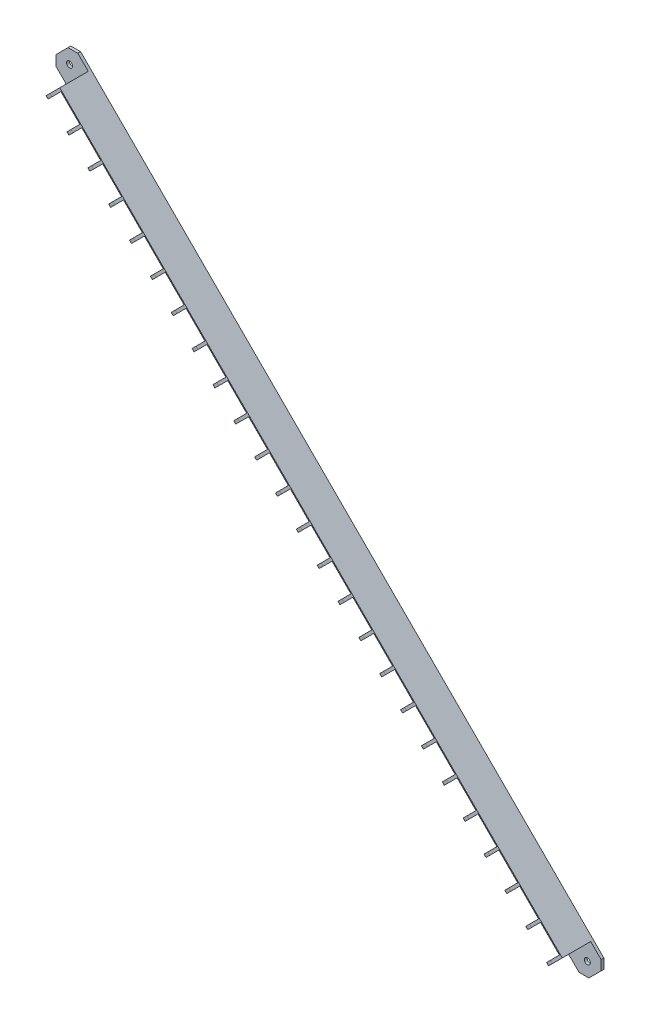
from build123d import *

# Parameters (mm, degrees)
BOSS_EXTRUDE2_DEPTH = 15.4
BOSS_EXTRUDE4_DEPTH = 1.6
LPATTERN1_COUNT     = 24
LPATTERN1_PITCH     = 17
BOSS_EXTRUDE5_START = 1.6
BOSS_EXTRUDE5_DEPTH = 1.6
SKETCH5_R           = 1.75
BOSS_EXTRUDE6_DEPTH = 1.6
CHAMFER1_SIZE       = 4


# Read off the part's stored shape, not the designer's step: Imported1
with BuildPart() as part:
    # Sketch2 → Boss-Extrude2 (new body)
    with BuildSketch(Plane(origin=(-84.711375962, 84.711326374, 0), x_dir=(0, 0, 1), z_dir=(-0.7071069881470023, 0.7071065742260323, 0))):
        with BuildLine():
            Line((17.999999225, 185.776650849), (17.999999225, 185.215701934))
            ThreePointArc((17.999999225, 185.215701934), (17.943392582, 185.010537776), (17.789566889, 184.863451745))
            Line((17.789566889, 184.863451745), (11.840286665, 181.661737422))
            ThreePointArc((11.840286665, 181.661737422), (10.948821205, 181.606515994), (10.368812829, 182.285743759))
            Line((10.368812829, 182.285743759), (9.722721647, 183.478557215))
            Line((9.722721647, 183.478557215), (9.01561146, 184.185660591))
            Line((9.01561146, 184.185660591), (1.590990258, 176.761039388))
            Line((1.590990258, 176.761039388), (2.298093634, 176.053929202))
            Line((2.298093634, 176.053929202), (3.49090709, 175.407838019))
            ThreePointArc((3.49090709, 175.407838019), (4.170134855, 174.827829644), (4.114913426, 173.936364184))
            Line((4.114913426, 173.936364184), (0.913199103, 167.987083959))
            ThreePointArc((0.913199103, 167.987083959), (0.766113073, 167.833258267), (0.560948914, 167.776651623))
            Line((0.560948914, 167.776651623), (0, 167.776651623))
            Line((0, 167.776651623), (0, 185.776650849))
            Line((0, 185.776650849), (17.999999225, 185.776650849))
        make_face()
    extrude(amount=BOSS_EXTRUDE2_DEPTH)

    # Sketch3 → Boss-Extrude4 (add)
    with BuildSketch(Plane(origin=(-84.711375962, 84.711326374, 0), x_dir=(0, 0, 1), z_dir=(-0.7071069881470023, 0.7071065742260323, 0))):
        with BuildLine():
            Line((17.999999225, 185.776650849), (17.999999225, 177.776650849))
            ThreePointArc((17.999999225, 177.776650849), (15.071067538, 170.705583859), (8.000000775, 167.776651623))
            Line((8.000000775, 167.776651623), (0, 167.776651623))
            Line((0, 167.776651623), (0, 185.776650849))
            Line((0, 185.776650849), (17.999999225, 185.776650849))
        make_face()
        with BuildLine():
            Line((7.424621202, 178.352029646), (10.253048327, 181.180456771))
            ThreePointArc((10.253048327, 181.180456771), (10.478608064, 181.715538219), (10.368812829, 182.285743759))
            Line((10.368812829, 182.285743759), (9.722721647, 183.478557215))
            Line((9.722721647, 183.478557215), (9.01561146, 184.185660591))
            Line((9.01561146, 184.185660591), (1.590990258, 176.761039388))
            Line((1.590990258, 176.761039388), (2.298093634, 176.053929202))
            Line((2.298093634, 176.053929202), (3.49090709, 175.407838019))
            ThreePointArc((3.49090709, 175.407838019), (4.06111263, 175.298042785), (4.596194078, 175.523602521))
            Line((4.596194078, 175.523602521), (7.424621202, 178.352029646))
        make_face(mode=Mode.SUBTRACT)
    extrude(amount=-BOSS_EXTRUDE4_DEPTH)


with BuildPart() as lpattern1_1:
    # LPattern1: pattern copy
    add(part.part.moved(Location(Vector(-0.7071069881470021, 0.7071065742260323, 0) * (1 * LPATTERN1_PITCH))))


with BuildPart() as lpattern1_2:
    # LPattern1: pattern copy
    add(part.part.moved(Location(Vector(-0.7071069881470021, 0.7071065742260323, 0) * (2 * LPATTERN1_PITCH))))


with BuildPart() as lpattern1_3:
    # LPattern1: pattern copy
    add(part.part.moved(Location(Vector(-0.7071069881470021, 0.7071065742260323, 0) * (3 * LPATTERN1_PITCH))))


with BuildPart() as lpattern1_4:
    # LPattern1: pattern copy
    add(part.part.moved(Location(Vector(-0.7071069881470021, 0.7071065742260323, 0) * (4 * LPATTERN1_PITCH))))


with BuildPart() as lpattern1_5:
    # LPattern1: pattern copy
    add(part.part.moved(Location(Vector(-0.7071069881470021, 0.7071065742260323, 0) * (5 * LPATTERN1_PITCH))))


with BuildPart() as lpattern1_6:
    # LPattern1: pattern copy
    add(part.part.moved(Location(Vector(-0.7071069881470021, 0.7071065742260323, 0) * (6 * LPATTERN1_PITCH))))


with BuildPart() as lpattern1_7:
    # LPattern1: pattern copy
    add(part.part.moved(Location(Vector(-0.7071069881470021, 0.7071065742260323, 0) * (7 * LPATTERN1_PITCH))))


with BuildPart() as lpattern1_8:
    # LPattern1: pattern copy
    add(part.part.moved(Location(Vector(-0.7071069881470021, 0.7071065742260323, 0) * (8 * LPATTERN1_PITCH))))


with BuildPart() as lpattern1_9:
    # LPattern1: pattern copy
    add(part.part.moved(Location(Vector(-0.7071069881470021, 0.7071065742260323, 0) * (9 * LPATTERN1_PITCH))))


with BuildPart() as lpattern1_10:
    # LPattern1: pattern copy
    add(part.part.moved(Location(Vector(-0.7071069881470021, 0.7071065742260323, 0) * (10 * LPATTERN1_PITCH))))


with BuildPart() as lpattern1_11:
    # LPattern1: pattern copy
    add(part.part.moved(Location(Vector(-0.7071069881470021, 0.7071065742260323, 0) * (11 * LPATTERN1_PITCH))))


with BuildPart() as lpattern1_12:
    # LPattern1: pattern copy
    add(part.part.moved(Location(Vector(-0.7071069881470021, 0.7071065742260323, 0) * (12 * LPATTERN1_PITCH))))


with BuildPart() as lpattern1_13:
    # LPattern1: pattern copy
    add(part.part.moved(Location(Vector(-0.7071069881470021, 0.7071065742260323, 0) * (13 * LPATTERN1_PITCH))))


with BuildPart() as lpattern1_14:
    # LPattern1: pattern copy
    add(part.part.moved(Location(Vector(-0.7071069881470021, 0.7071065742260323, 0) * (14 * LPATTERN1_PITCH))))


with BuildPart() as lpattern1_15:
    # LPattern1: pattern copy
    add(part.part.moved(Location(Vector(-0.7071069881470021, 0.7071065742260323, 0) * (15 * LPATTERN1_PITCH))))


with BuildPart() as lpattern1_16:
    # LPattern1: pattern copy
    add(part.part.moved(Location(Vector(-0.7071069881470021, 0.7071065742260323, 0) * (16 * LPATTERN1_PITCH))))


with BuildPart() as lpattern1_17:
    # LPattern1: pattern copy
    add(part.part.moved(Location(Vector(-0.7071069881470021, 0.7071065742260323, 0) * (17 * LPATTERN1_PITCH))))


with BuildPart() as lpattern1_18:
    # LPattern1: pattern copy
    add(part.part.moved(Location(Vector(-0.7071069881470021, 0.7071065742260323, 0) * (18 * LPATTERN1_PITCH))))


with BuildPart() as lpattern1_19:
    # LPattern1: pattern copy
    add(part.part.moved(Location(Vector(-0.7071069881470021, 0.7071065742260323, 0) * (19 * LPATTERN1_PITCH))))


with BuildPart() as lpattern1_20:
    # LPattern1: pattern copy
    add(part.part.moved(Location(Vector(-0.7071069881470021, 0.7071065742260323, 0) * (20 * LPATTERN1_PITCH))))


with BuildPart() as lpattern1_21:
    # LPattern1: pattern copy
    add(part.part.moved(Location(Vector(-0.7071069881470021, 0.7071065742260323, 0) * (21 * LPATTERN1_PITCH))))


with BuildPart() as lpattern1_22:
    # LPattern1: pattern copy
    add(part.part.moved(Location(Vector(-0.7071069881470021, 0.7071065742260323, 0) * (22 * LPATTERN1_PITCH))))


with BuildPart() as lpattern1_23:
    # LPattern1: pattern copy
    add(part.part.moved(Location(Vector(-0.7071069881470021, 0.7071065742260323, 0) * (23 * LPATTERN1_PITCH))))


with BuildPart() as body_25:
    # Sketch4 → Boss-Extrude5 (new body)
    with BuildSketch(Plane(origin=(-372.079655944, 372.079438139, 0), x_dir=(0, 0, 1), z_dir=(-0.7071069881470021, 0.7071065742260323, 0)).offset(BOSS_EXTRUDE5_START)):
        with BuildLine():
            Line((17.999999225, 177.776650849), (17.999999225, 185.776650849))
            Line((17.999999225, 185.776650849), (0, 185.776650849))
            Line((0, 185.776650849), (0, 167.776651623))
            Line((0, 167.776651623), (8.000000775, 167.776651623))
            ThreePointArc((8.000000775, 167.776651623), (15.071067538, 170.705583859), (17.999999225, 177.776650849))
        make_face()
        with BuildLine():
            Line((2.298093634, 176.053929202), (3.49090709, 175.407838019))
            ThreePointArc((3.49090709, 175.407838019), (4.06111263, 175.298042785), (4.596194078, 175.523602521))
            Line((4.596194078, 175.523602521), (7.424621202, 178.352029646))
            Line((7.424621202, 178.352029646), (10.253048327, 181.180456771))
            ThreePointArc((10.253048327, 181.180456771), (10.478608064, 181.715538219), (10.368812829, 182.285743759))
            Line((10.368812829, 182.285743759), (9.722721647, 183.478557215))
            Line((9.722721647, 183.478557215), (9.01561146, 184.185660591))
            Line((9.01561146, 184.185660591), (1.590990258, 176.761039388))
            Line((1.590990258, 176.761039388), (2.298093634, 176.053929202))
        make_face(mode=Mode.SUBTRACT)
    extrude(amount=-BOSS_EXTRUDE5_DEPTH)


with BuildPart() as lpattern1_1_1:
    add(lpattern1_1.part)

    # Combine1: union LPattern1_18, LPattern1_11, LPattern1_4, LPattern1_14, LPattern1_7, LPattern1_10, LPattern1_3, LPattern1_20, LPattern1_13, part, LPattern1_6, body 25, LPattern1_9, LPattern1_2, LPattern1_19, LPattern1_12, LPattern1_5, LPattern1_15, LPattern1_8, LPattern1_16, LPattern1_17, LPattern1_21, LPattern1_22, LPattern1_23
    add(lpattern1_18.part)
    add(lpattern1_11.part)
    add(lpattern1_4.part)
    add(lpattern1_14.part)
    add(lpattern1_7.part)
    add(lpattern1_10.part)
    add(lpattern1_3.part)
    add(lpattern1_20.part)
    add(lpattern1_13.part)
    add(part.part)
    add(lpattern1_6.part)
    add(body_25.part)
    add(lpattern1_9.part)
    add(lpattern1_2.part)
    add(lpattern1_19.part)
    add(lpattern1_12.part)
    add(lpattern1_5.part)
    add(lpattern1_15.part)
    add(lpattern1_8.part)
    add(lpattern1_16.part)
    add(lpattern1_17.part)
    add(lpattern1_21.part)
    add(lpattern1_22.part)
    add(lpattern1_23.part)

    # Sketch5 → Boss-Extrude6 (add)
    # profile 1 of 2: a face of its own
    with BuildSketch(Plane(origin=(0, 0, 0), x_dir=(-1, 0, 0), z_dir=(0, 0, -1))):
        Polygon((254.575053761, 491.846851469), (263.413891113, 500.685683647), (250.685973325, 513.413608885), (241.847135973, 504.574776708), align=None)
        with Locations(Location((252.636033163, 502.624710554, 0), (0, 0, 90))):
            Circle(SKETCH5_R, mode=Mode.SUBTRACT)
    # profile 2 of 2: a face of its own
    with BuildSketch(Plane(origin=(0, 0, 0), x_dir=(-1, 0, 0), z_dir=(0, 0, -1))):
        Polygon((-35.055968584, 202.215998666), (-47.783886372, 214.943923905), (-56.622723724, 206.105091727), (-43.894805936, 193.377166488), align=None)
        with Locations(Location((-45.833826534, 204.155025573, 0), (0, 0, 270))):
            Circle(SKETCH5_R, mode=Mode.SUBTRACT)
    extrude(amount=-BOSS_EXTRUDE6_DEPTH)

    # Chamfer1
    chamfer1_edges = [lpattern1_1_1.edges().sort_by_distance(p)[0] for p in [
        (-250.685973325, 513.413608885, 0.8),
        (-263.413891113, 500.685683647, 0.8),
        (43.894805936, 193.377166488, 0.8),
        (56.622723724, 206.105091727, 0.8),
    ]]
    chamfer(chamfer1_edges, length=CHAMFER1_SIZE)


solid = lpattern1_1_1.part
